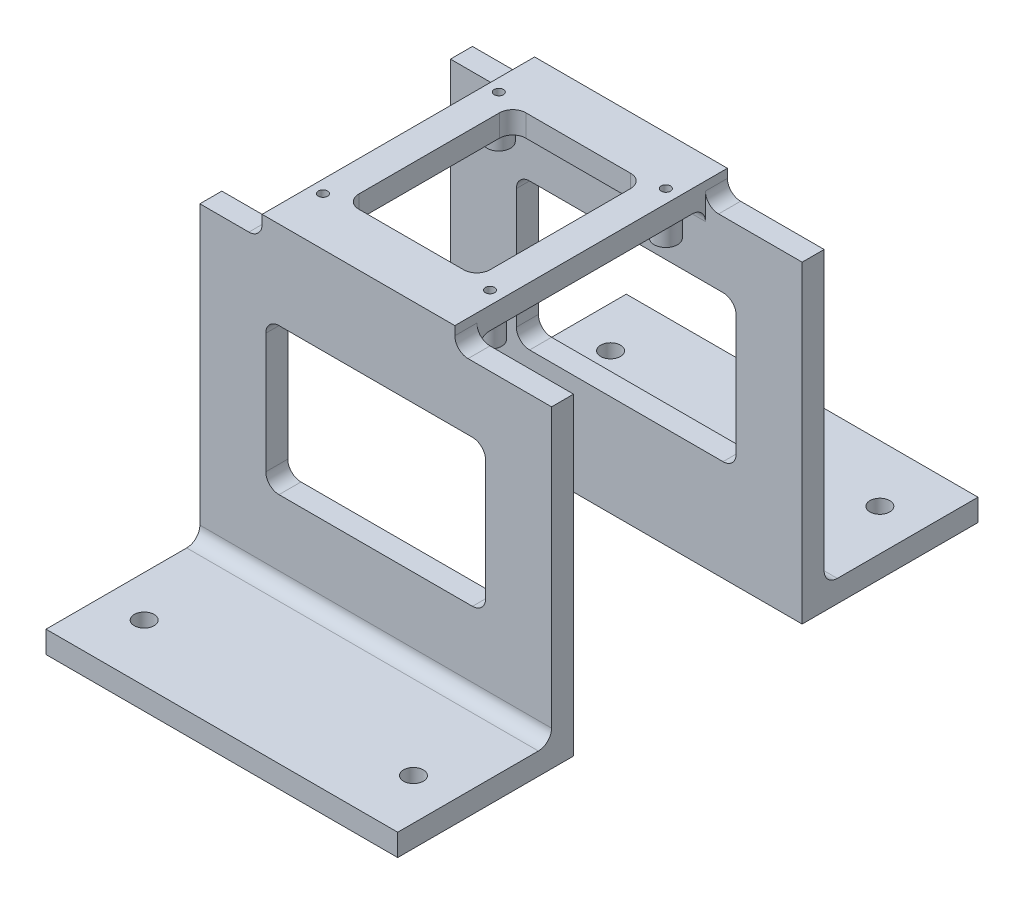
from build123d import *

# Parameters (mm, degrees)
SKETCH1_W               = 80
SKETCH1_H               = 40
SKETCH1_R               = 2.25
BOSS_EXTRUDE1_DEPTH     = 5
BOSS_EXTRUDE1_2_DEPTH   = 5
SKETCH2_W               = 80
SKETCH2_H               = 5
BOSS_EXTRUDE2_DEPTH     = 66.3
SKETCH3_W               = 43.85
SKETCH3_H               = 62
BOSS_EXTRUDE3_DEPTH     = 5
SKETCH5_W               = 29.85
SKETCH5_H               = 38
CUT_EXTRUDE2_DEPTH      = 10
CUT_EXTRUDE1_REACH      = 110.525
SKETCH4_R               = 1.05
FILLET1_R               = 3
FILLET2_R               = 3
CUT_EXTRUDE3_DEPTH      = 130.733149195
CUT_EXTRUDE3_DEPTH_BACK = 130.733149195
SKETCH6_W               = 50
SKETCH6_H               = 33.3
FILLET3_R               = 3
SKETCH9_R               = 2.65
SKETCH9_R_2             = 1.05
BOSS_EXTRUDE5_DEPTH     = 4.75


with BuildPart() as part:
    # Sketch1 → Boss-Extrude1 (new body)
    with BuildSketch(Plane(origin=(0, 0, 0), x_dir=(1, 0, 0), z_dir=(0, 1, 0))):
        with Locations((0, 46)):
            Rectangle(SKETCH1_W, SKETCH1_H)
        with Locations((-30.625, 53.044055982)):
            Circle(SKETCH1_R, mode=Mode.SUBTRACT)
        with Locations((30.625, 53.044055982)):
            Circle(SKETCH1_R, mode=Mode.SUBTRACT)
    extrude(amount=BOSS_EXTRUDE1_DEPTH)



with BuildPart() as body_2:
    # Sketch1 → Boss-Extrude1 2 (new body)
    with BuildSketch(Plane(origin=(0, 0, 0), x_dir=(1, 0, 0), z_dir=(0, 1, 0))):
        with Locations((0, -46)):
            Rectangle(SKETCH1_W, SKETCH1_H)
        with Locations((30.625, -53.044055982)):
            Circle(SKETCH1_R, mode=Mode.SUBTRACT)
        with Locations((-30.625, -53.044055982)):
            Circle(SKETCH1_R, mode=Mode.SUBTRACT)
    extrude(amount=BOSS_EXTRUDE1_2_DEPTH)


with BuildPart() as part_1:
    add(part.part)

    add(body_2.part)  # Boss-Extrude2 merges body 2
    # Sketch2 → Boss-Extrude2 (add)
    with BuildSketch(Plane(origin=(0, 5, 0), x_dir=(1, 0, 0), z_dir=(0, 1, 0))):
        with Locations((0, 28.5)):
            Rectangle(SKETCH2_W, SKETCH2_H)
        with Locations((0, -28.5)):
            Rectangle(SKETCH2_W, SKETCH2_H)
    extrude(amount=BOSS_EXTRUDE2_DEPTH)

    # Sketch3 → Boss-Extrude3 (add)
    with BuildSketch(Plane(origin=(0, 71.3, 0), x_dir=(1, 0, 0), z_dir=(0, 1, 0))):
        with Locations((-3.925, 0)):
            Rectangle(SKETCH3_W, SKETCH3_H)
    extrude(amount=BOSS_EXTRUDE3_DEPTH)

    # Sketch5 → Cut-Extrude2 (cut)
    with BuildSketch(Plane.XZ.offset(-71.3)):
        with Locations((-3.925, 0)):
            Rectangle(SKETCH5_W, SKETCH5_H)
    extrude(amount=-CUT_EXTRUDE2_DEPTH, mode=Mode.SUBTRACT)

    # Sketch4 → Cut-Extrude1 (cut, up to next)
    with BuildSketch(Plane(origin=(0, 76.3, 0), x_dir=(1, 0, 0), z_dir=(0, 1, 0)), mode=Mode.PRIVATE) as cut_extrude1_sk1:
        with Locations((-23, 20)):
            Circle(SKETCH4_R)
    cut_extrude1_tool1 = extrude(cut_extrude1_sk1.sketch, amount=-CUT_EXTRUDE1_REACH, mode=Mode.PRIVATE) & part_1.part
    # Sketch4 → Cut-Extrude1 (cut, up to next)
    with BuildSketch(Plane(origin=(0, 76.3, 0), x_dir=(1, 0, 0), z_dir=(0, 1, 0)), mode=Mode.PRIVATE) as cut_extrude1_sk2:
        with Locations((15, 20)):
            Circle(SKETCH4_R)
    cut_extrude1_tool2 = extrude(cut_extrude1_sk2.sketch, amount=-CUT_EXTRUDE1_REACH, mode=Mode.PRIVATE) & part_1.part
    # Sketch4 → Cut-Extrude1 (cut, up to next)
    with BuildSketch(Plane(origin=(0, 76.3, 0), x_dir=(1, 0, 0), z_dir=(0, 1, 0)), mode=Mode.PRIVATE) as cut_extrude1_sk3:
        with Locations((15, -20)):
            Circle(SKETCH4_R)
    cut_extrude1_tool3 = extrude(cut_extrude1_sk3.sketch, amount=-CUT_EXTRUDE1_REACH, mode=Mode.PRIVATE) & part_1.part
    # Sketch4 → Cut-Extrude1 (cut, up to next)
    with BuildSketch(Plane(origin=(0, 76.3, 0), x_dir=(1, 0, 0), z_dir=(0, 1, 0)), mode=Mode.PRIVATE) as cut_extrude1_sk4:
        with Locations((-23, -20)):
            Circle(SKETCH4_R)
    cut_extrude1_tool4 = extrude(cut_extrude1_sk4.sketch, amount=-CUT_EXTRUDE1_REACH, mode=Mode.PRIVATE) & part_1.part
    add(cut_extrude1_tool1.solids().sort_by_distance((-23, 76.3, -20))[0], mode=Mode.SUBTRACT)
    add(cut_extrude1_tool2.solids().sort_by_distance((15, 76.3, -20))[0], mode=Mode.SUBTRACT)
    add(cut_extrude1_tool3.solids().sort_by_distance((15, 76.3, 20))[0], mode=Mode.SUBTRACT)
    add(cut_extrude1_tool4.solids().sort_by_distance((-23, 76.3, 20))[0], mode=Mode.SUBTRACT)

    # Fillet1
    fillet1_edges = [part_1.edges().sort_by_distance(p)[0] for p in [
        (-3.925, 71.3, -26),
        (-3.925, 71.3, 26),
        (0, 5, -31),
        (0, 5, 31),
    ]]
    fillet(fillet1_edges, radius=FILLET1_R)

    # Fillet2
    fillet2_edges = [part_1.edges().sort_by_distance(p)[0] for p in [
        (18, 71.3, -28.5),
        (-25.85, 71.3, -28.5),
        (-25.85, 71.3, 28.5),
        (18, 71.3, 28.5),
    ]]
    fillet(fillet2_edges, radius=FILLET2_R)

    # Sketch6 → Cut-Extrude3 (cut, two sides: drawn at the far end of the back side and taken through both)
    with BuildSketch(Plane.XY.offset(31).offset(-CUT_EXTRUDE3_DEPTH_BACK)):
        with Locations((0, 39.65)):
            Rectangle(SKETCH6_W, SKETCH6_H)
    extrude(amount=CUT_EXTRUDE3_DEPTH + CUT_EXTRUDE3_DEPTH_BACK, mode=Mode.SUBTRACT)

    # Fillet3
    fillet3_edges = [part_1.edges().sort_by_distance(p)[0] for p in [
        (-25, 56.3, -28.5),
        (25, 56.3, -28.5),
        (25, 23, -28.5),
        (-25, 23, -28.5),
        (-25, 56.3, 28.5),
        (25, 56.3, 28.5),
        (25, 23, 28.5),
        (-25, 23, 28.5),
        (-18.85, 73.8, -19),
        (-18.85, 73.8, 19),
        (11, 73.8, 19),
        (11, 73.8, -19),
    ]]
    fillet(fillet3_edges, radius=FILLET3_R)

    # Sketch9 → Boss-Extrude5 (add)
    # profile 1 of 4: a face of its own
    with BuildSketch(Plane.XZ.offset(-71.3)):
        with Locations((-23, 20)):
            Circle(SKETCH9_R)
        with Locations((-23, 20)):
            Circle(SKETCH9_R_2, mode=Mode.SUBTRACT)
    # profile 2 of 4: a face of its own
    with BuildSketch(Plane.XZ.offset(-71.3)):
        with Locations((-23, -20)):
            Circle(SKETCH9_R)
        with Locations((-23, -20)):
            Circle(SKETCH9_R_2, mode=Mode.SUBTRACT)
    # profile 3 of 4: a face of its own
    with BuildSketch(Plane.XZ.offset(-71.3)):
        with Locations((15, 20)):
            Circle(SKETCH9_R)
        with Locations((15, 20)):
            Circle(SKETCH9_R_2, mode=Mode.SUBTRACT)
    # profile 4 of 4: a face of its own
    with BuildSketch(Plane.XZ.offset(-71.3)):
        with Locations((15, -20)):
            Circle(SKETCH9_R)
        with Locations((15, -20)):
            Circle(SKETCH9_R_2, mode=Mode.SUBTRACT)
    extrude(amount=BOSS_EXTRUDE5_DEPTH)


solid = part_1.part
